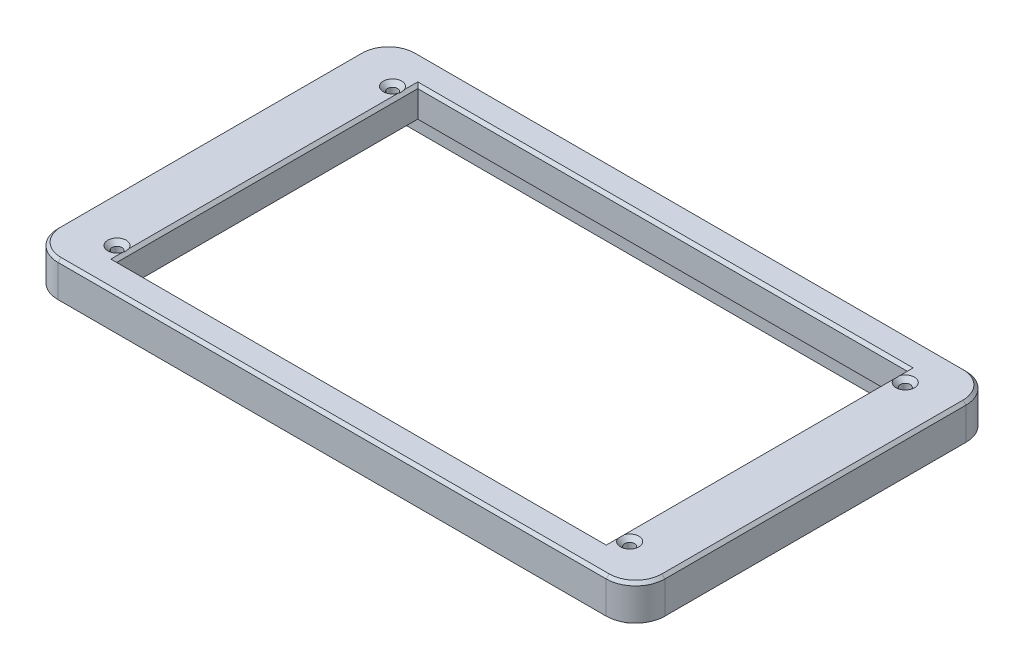
from build123d import *

# Parameters (mm, degrees)
SKETCH1_W                                            = 207
SKETCH1_H                                            = 122.7
SKETCH1_W_2                                          = 167
SKETCH1_H_2                                          = 102.7
EXTRUDE1_DEPTH                                       = 12
FILLET1_R                                            = 10
CHAMFER1_SIZE                                        = 1
SKETCH2_W                                            = 186.9
SKETCH2_H                                            = 106
EXTRUDE2_DEPTH                                       = 2
FILLET2_R                                            = 2.5
SKETCH3_W                                            = 195
SKETCH3_H                                            = 112.7
EXTRUDE3_DEPTH                                       = 3.5
F_2_0_2_DIAMETER_HOLE1_D                             = 2
CSK_FOR_M3_COUNTERSUNK_RAISED_HEAD_SCREW_D           = 3.4
CSK_FOR_M3_COUNTERSUNK_RAISED_HEAD_SCREW_CSINK_D     = 6.3
CSK_FOR_M3_COUNTERSUNK_RAISED_HEAD_SCREW_CSINK_ANGLE = 90
CHAMFER2_SIZE                                        = 2
SKETCH12_W                                           = 30
SKETCH12_H                                           = 2
EXTRUDE4_DEPTH                                       = 1.5
FILLET3_R                                            = 1
SKETCH13_W                                           = 30
SKETCH13_H                                           = 2
EXTRUDE5_DEPTH                                       = 1.5
FILLET4_R                                            = 1
SKETCH14_W                                           = 30
SKETCH14_H                                           = 2
EXTRUDE6_DEPTH                                       = 1.5
FILLET5_R                                            = 1
SKETCH15_W                                           = 30
SKETCH15_H                                           = 2
EXTRUDE7_DEPTH                                       = 1.5
FILLET6_R                                            = 1


with BuildPart() as part:
    # Sketch1 → Extrude1 (new body)
    with BuildSketch(Plane(origin=(0, 0, 0), x_dir=(1, 0, 0), z_dir=(0, 1, 0))):
        Rectangle(SKETCH1_W, SKETCH1_H)
        Rectangle(SKETCH1_W_2, SKETCH1_H_2, mode=Mode.SUBTRACT)
    extrude(amount=EXTRUDE1_DEPTH)

    # Fillet1
    fillet1_edges = [part.edges().sort_by_distance(p)[0] for p in [
        (-103.5, 6, -61.35),
        (103.5, 6, -61.35),
        (103.5, 6, 61.35),
        (-103.5, 6, 61.35),
    ]]
    fillet(fillet1_edges, radius=FILLET1_R)

    # Chamfer1
    chamfer1_edges = [part.edges().sort_by_distance(p)[0] for p in [
        (-83.5, 12, 0),
        (0, 12, 51.35),
        (83.5, 12, 0),
        (0, 12, -51.35),
        (103.5, 12, 0),
        (0, 12, 61.35),
        (-103.5, 12, 0),
        (0, 12, -61.35),
        (-100.571067812, 12, 58.421067812),
        (-100.571067812, 12, -58.421067812),
        (100.571067812, 12, -58.421067812),
        (100.571067812, 12, 58.421067812),
    ]]
    chamfer(chamfer1_edges, length=CHAMFER1_SIZE)

    # Sketch2 → Extrude2 (cut)
    with BuildSketch(Plane.XZ):
        Rectangle(SKETCH2_W, SKETCH2_H)
    extrude(amount=-EXTRUDE2_DEPTH, mode=Mode.SUBTRACT)

    # Fillet2
    fillet2_edges = [part.edges().sort_by_distance(p)[0] for p in [
        (-93.45, 1, -53),
        (-93.45, 1, 53),
        (93.45, 1, 53),
        (93.45, 1, -53),
    ]]
    fillet(fillet2_edges, radius=FILLET2_R)

    # Sketch3 → Extrude3 (add)
    with BuildSketch(Plane.XZ):
        Rectangle(SKETCH3_W, SKETCH3_H)
        with BuildLine():
            Line((-90.95, -53), (90.95, -53))
            ThreePointArc((90.95, -53), (92.717766953, -52.267766953), (93.45, -50.5))
            Line((93.45, -50.5), (93.45, 50.5))
            ThreePointArc((93.45, 50.5), (92.717766953, 52.267766953), (90.95, 53))
            Line((90.95, 53), (-90.95, 53))
            ThreePointArc((-90.95, 53), (-92.717766953, 52.267766953), (-93.45, 50.5))
            Line((-93.45, 50.5), (-93.45, -50.5))
            ThreePointArc((-93.45, -50.5), (-92.717766953, -52.267766953), (-90.95, -53))
        make_face(mode=Mode.SUBTRACT)
    extrude(amount=EXTRUDE3_DEPTH)

    # Ø2.0 (2) Diameter Hole1 (through all)
    with Locations(Plane(origin=(-103.5, 2, 61.35), x_dir=(1, 0, 0), z_dir=(0, -1, 0))):
        with Locations((190.95, -14.05), (190.95, -108.05), (16.05, -108.05), (16.05, -14.05)):
            Hole(F_2_0_2_DIAMETER_HOLE1_D / 2)

    # CSK for M3 Countersunk Raised Head Screw2 (through all)
    with Locations(Plane(origin=(0, 12, 0), x_dir=(1, 0, 0), z_dir=(0, 1, 0))):
        with Locations((87.45, 46.7), (87.45, -47.3), (-87.45, -47.3), (-87.45, 46.7)):
            CounterSinkHole(CSK_FOR_M3_COUNTERSUNK_RAISED_HEAD_SCREW_D / 2, CSK_FOR_M3_COUNTERSUNK_RAISED_HEAD_SCREW_CSINK_D / 2, counter_sink_angle=CSK_FOR_M3_COUNTERSUNK_RAISED_HEAD_SCREW_CSINK_ANGLE)

    # Chamfer2
    chamfer2_edges = [part.edges().sort_by_distance(p)[0] for p in [
        (-97.5, -1.75, 56.35),
        (-97.5, -1.75, -56.35),
        (97.5, -1.75, -56.35),
        (97.5, -1.75, 56.35),
    ]]
    chamfer(chamfer2_edges, length=CHAMFER2_SIZE)

    # Sketch12 → Extrude4 (add)
    with BuildSketch(Plane.ZY.offset(97.5)):
        with Locations((0, -2.5)):
            Rectangle(SKETCH12_W, SKETCH12_H)
    extrude(amount=EXTRUDE4_DEPTH)

    # Fillet3
    fillet3_edges = [part.edges().sort_by_distance(p)[0] for p in [
        (-99, -3.5, 0),
        (-99, -1.5, 0),
    ]]
    fillet(fillet3_edges, radius=FILLET3_R - 0.0001)  # a hair under: the kernel refuses the full size

    # Sketch13 → Extrude5 (add)
    with BuildSketch(Plane(origin=(97.5, 0, 0), x_dir=(0, 0, -1), z_dir=(1, 0, 0))):
        with Locations((0, -2.5)):
            Rectangle(SKETCH13_W, SKETCH13_H)
    extrude(amount=EXTRUDE5_DEPTH)

    # Fillet4
    fillet4_edges = [part.edges().sort_by_distance(p)[0] for p in [
        (99, -1.5, 0),
        (99, -3.5, 0),
    ]]
    fillet(fillet4_edges, radius=FILLET4_R - 0.0001)  # a hair under: the kernel refuses the full size

    # Sketch14 → Extrude6 (add)
    with BuildSketch(Plane.XY.offset(56.35)):
        with Locations((0, -2.5)):
            Rectangle(SKETCH14_W, SKETCH14_H)
    extrude(amount=EXTRUDE6_DEPTH)

    # Fillet5
    fillet5_edges = [part.edges().sort_by_distance(p)[0] for p in [
        (0, -3.5, 57.85),
        (0, -1.5, 57.85),
    ]]
    fillet(fillet5_edges, radius=FILLET5_R - 0.0001)  # a hair under: the kernel refuses the full size

    # Sketch15 → Extrude7 (add)
    with BuildSketch(Plane(origin=(0, 0, -56.35), x_dir=(-1, 0, 0), z_dir=(0, 0, -1))):
        with Locations((0, -2.5)):
            Rectangle(SKETCH15_W, SKETCH15_H)
    extrude(amount=EXTRUDE7_DEPTH)

    # Fillet6
    fillet6_edges = [part.edges().sort_by_distance(p)[0] for p in [
        (0, -3.5, -57.85),
        (0, -1.5, -57.85),
    ]]
    fillet(fillet6_edges, radius=FILLET6_R - 0.0001)  # a hair under: the kernel refuses the full size


solid = part.part
